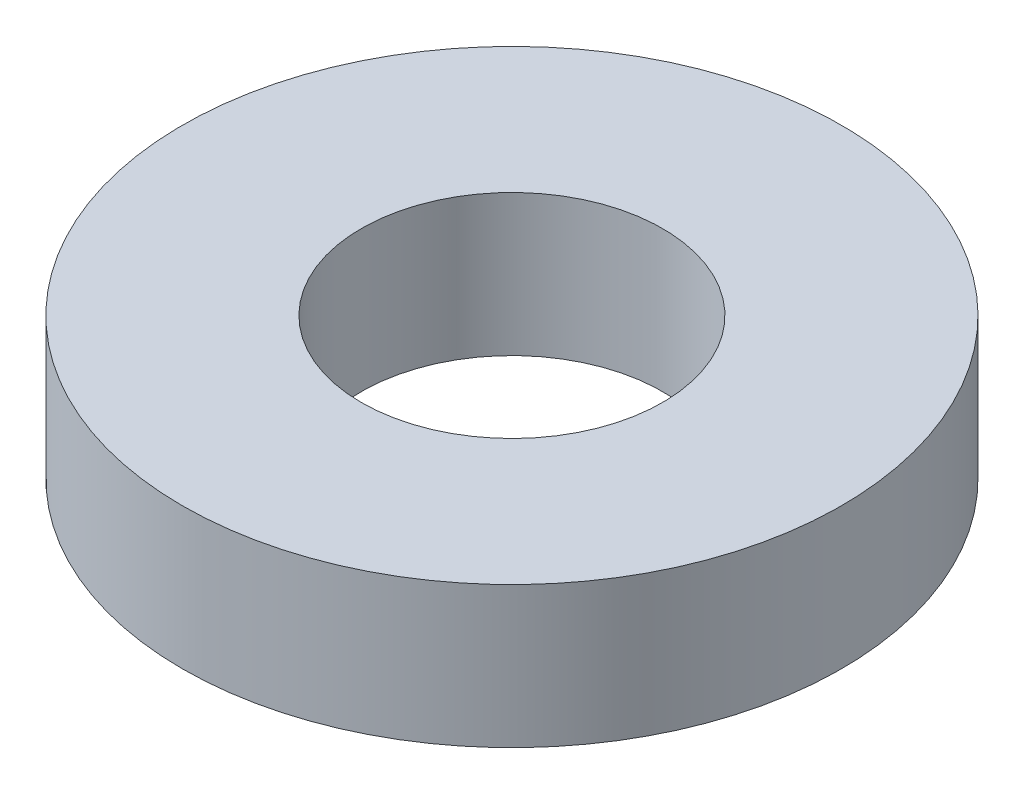
from build123d import *

# Parameters (mm, degrees)
SKETCH1_R           = 3.5
SKETCH1_R_2         = 1.6
BOSS_EXTRUDE1_DEPTH = 1.5


with BuildPart() as part:
    # Sketch1 → Boss-Extrude1 (new body)
    with BuildSketch(Plane(origin=(0, 0, 0), x_dir=(1, 0, 0), z_dir=(0, 1, 0))):
        Circle(SKETCH1_R)
        Circle(SKETCH1_R_2, mode=Mode.SUBTRACT)
    extrude(amount=BOSS_EXTRUDE1_DEPTH)


solid = part.part
